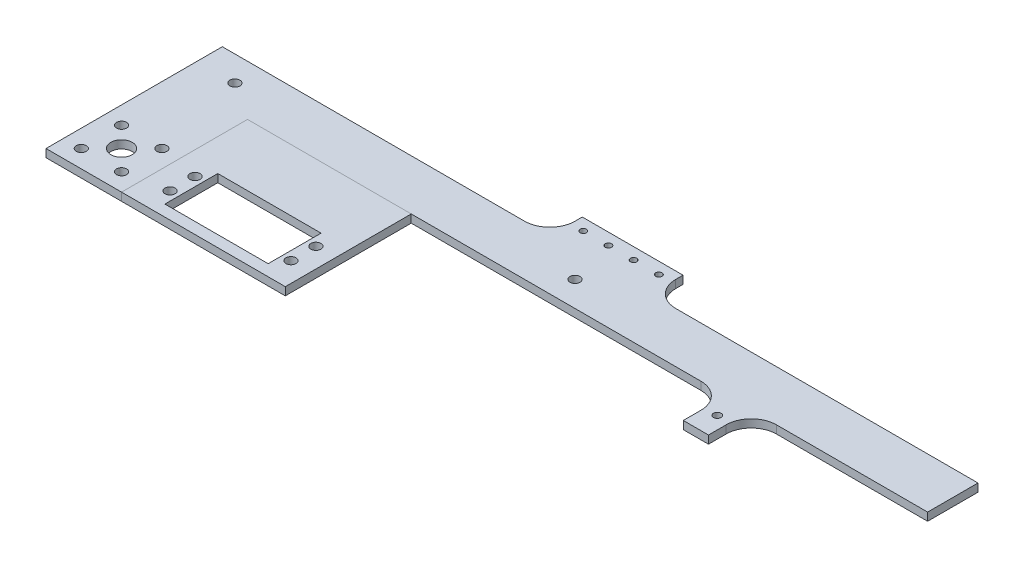
from build123d import *

# Parameters (mm, degrees)
SKETCH1_R           = 1.5
SKETCH1_R_2         = 2
SKETCH1_R_3         = 4.25
SKETCH1_R_4         = 1.25
BOSS_EXTRUDE1_DEPTH = 3.175
FILLET1_R           = 10
SKETCH2_W           = 70
SKETCH2_H           = 20
BOSS_EXTRUDE2_DEPTH = 3.175
FILLET2_R           = 10
SKETCH3_W           = 40
SKETCH3_H           = 3.7
CUT_EXTRUDE1_DEPTH  = 10
SKETCH4_W           = 41
SKETCH4_H           = 21
SKETCH4_R           = 2
BOSS_EXTRUDE3_DEPTH = 3.175


with BuildPart() as part:
    # Sketch1 → Boss-Extrude1 (new body)
    with BuildSketch(Plane(origin=(0, 0, 0), x_dir=(1, 0, 0), z_dir=(0, 1, 0))):
        Polygon((220, -17), (225, -17), (230, -17), (230, 10), (230, 20), (170, 20), (170, 36.6), (165, 36.6), (130, 36.6), (130, 20), (0, 20), (0, -50), (30, -50), (30, 0), (220, 0), align=None)
        with Locations((225, -8.5)):
            Circle(SKETCH1_R, mode=Mode.SUBTRACT)
        with Locations((15, 10)):
            Circle(SKETCH1_R_2, mode=Mode.SUBTRACT)
        with BuildLine():
            ThreePointArc((148, 10), (150, 12), (152, 10))
            ThreePointArc((152, 10), (150, 8), (148, 10))
        make_face(mode=Mode.SUBTRACT)
        with Locations((23, -27)):
            Circle(SKETCH1_R_2, mode=Mode.SUBTRACT)
        with Locations((7, -43)):
            Circle(SKETCH1_R_2, mode=Mode.SUBTRACT)
        with Locations((23, -43)):
            Circle(SKETCH1_R_2, mode=Mode.SUBTRACT)
        with Locations((15, -35)):
            Circle(SKETCH1_R_3, mode=Mode.SUBTRACT)
        with Locations((7, -27)):
            Circle(SKETCH1_R_2, mode=Mode.SUBTRACT)
        with Locations((155, 28.3)):
            Circle(SKETCH1_R_4, mode=Mode.SUBTRACT)
        with Locations((135, 28.3)):
            Circle(SKETCH1_R_4, mode=Mode.SUBTRACT)
        with Locations((145, 28.3)):
            Circle(SKETCH1_R_4, mode=Mode.SUBTRACT)
        with Locations((165, 28.3)):
            Circle(SKETCH1_R_4, mode=Mode.SUBTRACT)
    extrude(amount=BOSS_EXTRUDE1_DEPTH)

    # Fillet1
    fillet1_edges = [part.edges().sort_by_distance(p)[0] for p in [
        (220, 1.5875, 0),
        (170, 1.5875, -20),
        (130, 1.5875, -20),
    ]]
    fillet(fillet1_edges, radius=FILLET1_R)

    # Sketch2 → Boss-Extrude2 (add)
    with BuildSketch(Plane(origin=(0, 0, 0), x_dir=(-1, 0, 0), z_dir=(0, -1, 0))):
        with Locations((-265, 10)):
            Rectangle(SKETCH2_W, SKETCH2_H)
    extrude(amount=-BOSS_EXTRUDE2_DEPTH)

    # Fillet2
    fillet2_edges = [part.edges().sort_by_distance(p)[0] for p in [
        (230, 1.5875, 0),
    ]]
    fillet(fillet2_edges, radius=FILLET2_R)

    # Sketch3 → Cut-Extrude1 (cut)
    with BuildSketch(Plane(origin=(0, 0, 0), x_dir=(-1, 0, 0), z_dir=(0, -1, 0))):
        with Locations((-150, 34.75)):
            Rectangle(SKETCH3_W, SKETCH3_H)
    extrude(amount=-CUT_EXTRUDE1_DEPTH, mode=Mode.SUBTRACT)


with BuildPart() as body_2:
    # Sketch4 → Boss-Extrude3 (new body)
    with BuildSketch(Plane(origin=(0, 0, 0), x_dir=(-1, 0, 0), z_dir=(0, -1, 0))):
        Polygon((-95, -50), (-30, -50), (-30, -35), (-30, 0), (-95, 0), align=None)
        with Locations((-63.2, -35)):
            Rectangle(SKETCH4_W, SKETCH4_H, mode=Mode.SUBTRACT)
        with Locations((-39.2, -30.05)):
            Circle(SKETCH4_R, mode=Mode.SUBTRACT)
        with Locations((-87.2, -39.95)):
            Circle(SKETCH4_R, mode=Mode.SUBTRACT)
        with Locations((-87.2, -30.05)):
            Circle(SKETCH4_R, mode=Mode.SUBTRACT)
        with Locations((-39.2, -39.95)):
            Circle(SKETCH4_R, mode=Mode.SUBTRACT)
    extrude(amount=-BOSS_EXTRUDE3_DEPTH)


solid = Compound([part.part, body_2.part])
